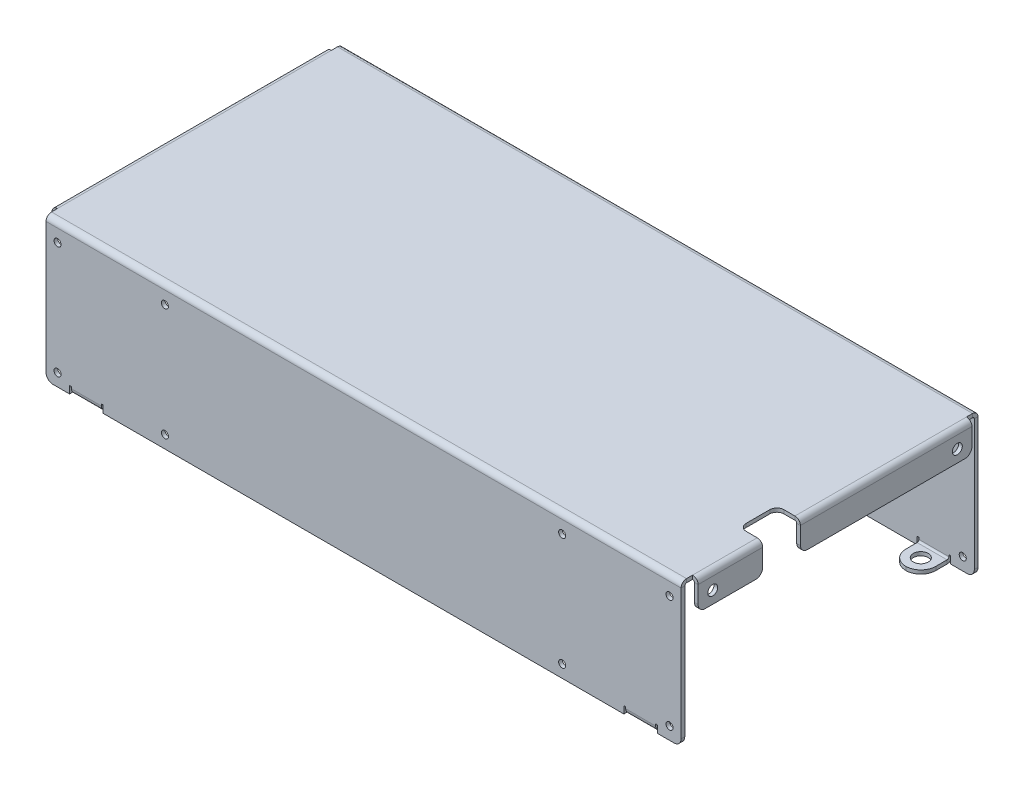
from build123d import *

# Parameters (mm, degrees)
SKETCH1_W                = 269.61
SKETCH1_H                = 121.4
BASE_FLANGE1_DEPTH       = 1.57
EDGE_FLANGE1_DEPTH       = 269.61
EDGE_FLANGE1_BEND_DEPTH  = 269.61
EDGE_FLANGE2_DEPTH       = 121.4
EDGE_FLANGE2_BEND_DEPTH  = 121.4
SKETCH30_W               = 0.8
SKETCH30_H               = 2.34
CUT_EXTRUDE1_DEPTH       = 170
EDGE_FLANGE3_START       = -124.005
EDGE_FLANGE3_DEPTH       = 12.7
EDGE_FLANGE3_START_2     = -124.79
EDGE_FLANGE3_2_OUTLINE_W = 0.775
EDGE_FLANGE3_2_OUTLINE_H = 1.57
EDGE_FLANGE3_2_DEPTH     = 0.785
EDGE_FLANGE3_START_3     = -111.305
EDGE_FLANGE3_3_OUTLINE_W = 0.775
EDGE_FLANGE3_3_OUTLINE_H = 1.57
EDGE_FLANGE3_3_DEPTH     = 0.785
EDGE_FLANGE3_4_DEPTH     = 12.7
FILLET1_R                = 6.35
SKETCH38_R               = 3.175
CUT_EXTRUDE2_DEPTH       = 10
FILLET1_OF_MIRROR2_R     = 6.35
MIRROR4_START            = 110.52
MIRROR4_DEPTH            = 14.27
MIRROR4_2_DEPTH          = 0.785
MIRROR4_START_2          = 124.005
MIRROR4_3_DEPTH          = 0.785
MIRROR4_START_3          = -60.77
MIRROR4_4_OUTLINE_R      = 3.175
MIRROR4_4_DEPTH          = 2.33
MIRROR4_START_4          = 111.305
MIRROR4_5_DEPTH          = 12.7
SKETCH39_R               = 2.11
CUT_EXTRUDE3_DEPTH       = 288.905899
CUT_EXTRUDE4_REACH       = 289.906
CUT_EXTRUDE5_DEPTH       = 2.33
FILLET3_R                = 3
SKETCH46_W               = 12.805982
SKETCH46_H               = 16
CUT_EXTRUDE6_DEPTH       = 20
FILLET4_R                = 3
FILLET5_R                = 3
SKETCH47_R               = 1.5
CUT_EXTRUDE7_DEPTH       = 196.933981
FILLET6_R                = 3


with BuildPart() as part:
    # Base-Flange1: sheet metal written as solids
    # Sketch1 → Base-Flange1 (new body)
    with BuildSketch(Plane(origin=(0, 0, 0), x_dir=(1, 0, 0), z_dir=(0, 1, 0))):
        Rectangle(SKETCH1_W, SKETCH1_H)
    extrude(amount=-BASE_FLANGE1_DEPTH)

    # Edge-Flange1: sheet metal written as solids
    # Edge-Flange1 section (on a plane across the edge) → Edge-Flange1 (add)
    with BuildSketch(Plane(origin=(134.805, -1.57, 61.46), x_dir=(0, 0, -1), z_dir=(-1, 0, 0))):
        with BuildLine():
            Line((-1.57, 0.76), (-1.57, 59.2))
            Line((-1.57, 59.2), (0, 59.2))
            Line((0, 59.2), (0, 0.76))
            ThreePointArc((0, 0.76), (0.222599, 0.222599), (0.76, 0))
            Line((0.76, 0), (0.76, -1.57))
            ThreePointArc((0.76, -1.57), (-0.887559, -0.887559), (-1.57, 0.76))
        make_face()
    extrude(amount=EDGE_FLANGE1_DEPTH)

    # Edge-Flange1 section 2 (on a plane across the edge) → Edge-Flange1 bend (add)
    with BuildSketch(Plane(origin=(-134.805, -1.57, -61.46), x_dir=(0, 0, 1), z_dir=(1, 0, 0))):
        with BuildLine():
            Line((-1.57, 0.76), (-1.57, 59.2))
            Line((-1.57, 59.2), (0, 59.2))
            Line((0, 59.2), (0, 0.76))
            ThreePointArc((0, 0.76), (0.222599, 0.222599), (0.76, 0))
            Line((0.76, 0), (0.76, -1.57))
            ThreePointArc((0.76, -1.57), (-0.887559, -0.887559), (-1.57, 0.76))
        make_face()
    extrude(amount=EDGE_FLANGE1_BEND_DEPTH)

    # Edge-Flange2: sheet metal written as solids
    # Edge-Flange2 section (on a plane across the edge) → Edge-Flange2 (add)
    with BuildSketch(Plane(origin=(135.565, -1.57, -60.7), x_dir=(-1, 0, 0), z_dir=(0, 0, 1))):
        with BuildLine():
            Line((-1.57, 0.76), (-1.57, 11.11))
            Line((-1.57, 11.11), (0, 11.11))
            Line((0, 11.11), (0, 0.76))
            ThreePointArc((0, 0.76), (0.222599, 0.222599), (0.76, 0))
            Line((0.76, 0), (0.76, -1.57))
            ThreePointArc((0.76, -1.57), (-0.887559, -0.887559), (-1.57, 0.76))
        make_face()
    extrude(amount=EDGE_FLANGE2_DEPTH)

    # Edge-Flange2 section 2 (on a plane across the edge) → Edge-Flange2 bend (add)
    with BuildSketch(Plane(origin=(-135.565, -1.57, 60.7), x_dir=(1, 0, 0), z_dir=(0, 0, -1))):
        with BuildLine():
            Line((-1.57, 0.76), (-1.57, 11.11))
            Line((-1.57, 11.11), (0, 11.11))
            Line((0, 11.11), (0, 0.76))
            ThreePointArc((0, 0.76), (0.222599, 0.222599), (0.76, 0))
            Line((0.76, 0), (0.76, -1.57))
            ThreePointArc((0.76, -1.57), (-0.887559, -0.887559), (-1.57, 0.76))
        make_face()
    extrude(amount=EDGE_FLANGE2_BEND_DEPTH)

    # Sketch30 → Cut-Extrude1 (cut)
    with BuildSketch(Plane.XY.offset(63.03)):
        with Locations((-110.905, -59.6)):
            Rectangle(SKETCH30_W, SKETCH30_H)
        with Locations((-124.405, -59.6)):
            Rectangle(SKETCH30_W, SKETCH30_H)
    extrude(amount=-CUT_EXTRUDE1_DEPTH, mode=Mode.SUBTRACT)

    # Edge-Flange3: read off the stored shape, not the designer's step
    # Edge-Flange3 outline → Edge-Flange3 (cut)
    with BuildSketch(Plane.YZ.offset(EDGE_FLANGE3_START)):
        with BuildLine():
            Line((-60.77, 61.46), (-60.642567, 61.46))
            ThreePointArc((-60.642567, 61.46), (-59.792424, 62.597327), (-58.44, 63.03))
            Line((-58.44, 63.03), (-60.77, 63.03))
            Line((-60.77, 63.03), (-60.77, 61.46))
        make_face()
    edge_flange3 = extrude(amount=EDGE_FLANGE3_DEPTH, mode=Mode.SUBTRACT)

    # Edge-Flange3 2 outline → Edge-Flange3 2 (cut)
    with BuildSketch(Plane.YZ.offset(EDGE_FLANGE3_START_2)):
        with Locations((-58.0425, 62.245)):
            Rectangle(EDGE_FLANGE3_2_OUTLINE_W, EDGE_FLANGE3_2_OUTLINE_H)
    edge_flange3_2 = extrude(amount=EDGE_FLANGE3_2_DEPTH, mode=Mode.SUBTRACT)

    # Edge-Flange3 3 outline → Edge-Flange3 3 (cut)
    with BuildSketch(Plane.YZ.offset(EDGE_FLANGE3_START_3)):
        with Locations((-58.0425, 62.245)):
            Rectangle(EDGE_FLANGE3_3_OUTLINE_W, EDGE_FLANGE3_3_OUTLINE_H)
    edge_flange3_3 = extrude(amount=EDGE_FLANGE3_3_DEPTH, mode=Mode.SUBTRACT)

    # Edge-Flange3 4 outline → Edge-Flange3 4 (add)
    with BuildSketch(Plane.YZ.offset(EDGE_FLANGE3_START)):
        with BuildLine():
            ThreePointArc((-60.642567, 61.46), (-60.737921, 61.085305), (-60.77, 60.7))
            Line((-60.77, 60.7), (-60.77, 49.55))
            Line((-60.77, 49.55), (-59.2, 49.55))
            Line((-59.2, 49.55), (-59.2, 60.7))
            ThreePointArc((-59.2, 60.7), (-58.977401, 61.237401), (-58.44, 61.46))
            Line((-58.44, 61.46), (-60.642567, 61.46))
        make_face()
    edge_flange3_4 = extrude(amount=EDGE_FLANGE3_4_DEPTH)

    # Fillet1
    fillet1_edges = [part.edges().sort_by_distance(p)[0] for p in [
        (-111.305, -59.985, 49.55),
        (-124.005, -59.985, 49.55),
    ]]
    fillet(fillet1_edges, radius=FILLET1_R - 0.0001)  # a hair under: the kernel refuses the full size

    # Sketch38 → Cut-Extrude2 (cut)
    with BuildSketch(Plane.XZ.offset(60.77)):
        with Locations(Location((-117.655, 55.9, 0), (0, 0, 270))):
            Circle(SKETCH38_R)
    cut_extrude2 = extrude(amount=-CUT_EXTRUDE2_DEPTH, mode=Mode.SUBTRACT)

    # Mirror2: Edge-Flange3, Edge-Flange3 2, Edge-Flange3 3, Edge-Flange3 4, Cut-Extrude2 across plane
    add(edge_flange3.mirror(Plane.XY), mode=Mode.SUBTRACT)
    add(edge_flange3_2.mirror(Plane.XY), mode=Mode.SUBTRACT)
    add(edge_flange3_3.mirror(Plane.XY), mode=Mode.SUBTRACT)
    add(edge_flange3_4.mirror(Plane.XY))
    add(cut_extrude2.mirror(Plane.XY), mode=Mode.SUBTRACT)

    # Fillet1 of Mirror2
    fillet1_of_mirror2_edges = [part.edges().sort_by_distance(p)[0] for p in [
        (-111.305, -59.985, -49.55),
        (-124.005, -59.985, -49.55),
    ]]
    fillet(fillet1_of_mirror2_edges, radius=FILLET1_OF_MIRROR2_R - 0.0001)  # a hair under: the kernel refuses the full size

    # Mirror4: read off the stored shape, not the designer's step
    # Mirror4 outline → Mirror4 (cut)
    with BuildSketch(Plane.YZ.offset(MIRROR4_START)):
        with BuildLine():
            Line((-60.77, -63.03), (-58.44, -63.03))
            ThreePointArc((-58.44, -63.03), (-59.792424, -62.597327), (-60.642567, -61.46))
            Line((-60.642567, -61.46), (-60.77, -61.46))
            Line((-60.77, -61.46), (-60.77, -63.03))
        make_face()
        with BuildLine():
            ThreePointArc((-60.642567, 61.46), (-59.792424, 62.597327), (-58.44, 63.03))
            Line((-58.44, 63.03), (-60.77, 63.03))
            Line((-60.77, 63.03), (-60.77, 61.46))
            Line((-60.77, 61.46), (-60.642567, 61.46))
        make_face()
    extrude(amount=MIRROR4_DEPTH, mode=Mode.SUBTRACT)

    # Mirror4 2 outline → Mirror4 2 (cut)
    with BuildSketch(Plane.YZ.offset(MIRROR4_START)):
        with BuildLine():
            Line((-57.655, -63.03), (-57.655, -61.46))
            Line((-57.655, -61.46), (-60.642567, -61.46))
            ThreePointArc((-60.642567, -61.46), (-59.792424, -62.597327), (-58.44, -63.03))
            Line((-58.44, -63.03), (-57.655, -63.03))
        make_face()
        with BuildLine():
            Line((-57.655, 61.46), (-57.655, 63.03))
            Line((-57.655, 63.03), (-58.44, 63.03))
            ThreePointArc((-58.44, 63.03), (-59.792424, 62.597327), (-60.642567, 61.46))
            Line((-60.642567, 61.46), (-57.655, 61.46))
        make_face()
    extrude(amount=MIRROR4_2_DEPTH, mode=Mode.SUBTRACT)

    # Mirror4 3 outline → Mirror4 3 (cut)
    with BuildSketch(Plane.YZ.offset(MIRROR4_START_2)):
        with BuildLine():
            Line((-57.655, -63.03), (-57.655, -61.46))
            Line((-57.655, -61.46), (-60.642567, -61.46))
            ThreePointArc((-60.642567, -61.46), (-59.792424, -62.597327), (-58.44, -63.03))
            Line((-58.44, -63.03), (-57.655, -63.03))
        make_face()
        with BuildLine():
            Line((-57.655, 61.46), (-57.655, 63.03))
            Line((-57.655, 63.03), (-58.44, 63.03))
            ThreePointArc((-58.44, 63.03), (-59.792424, 62.597327), (-60.642567, 61.46))
            Line((-60.642567, 61.46), (-57.655, 61.46))
        make_face()
    extrude(amount=MIRROR4_3_DEPTH, mode=Mode.SUBTRACT)

    # Mirror4 4 outline → Mirror4 4 (add)
    # profile 1 of 2: a face of its own
    with BuildSketch(Plane(origin=(0, 0, 0), x_dir=(1, 0, 0), z_dir=(0, 1, 0)).offset(MIRROR4_START_3)):
        with BuildLine():
            Line((124.005, 55.9), (124.005, 61.46))
            Line((124.005, 61.46), (111.305, 61.46))
            Line((111.305, 61.46), (111.305, 55.9))
            ThreePointArc((111.305, 55.9), (113.164872, 51.409872), (117.655, 49.55))
            ThreePointArc((117.655, 49.55), (122.145128, 51.409872), (124.005, 55.9))
        make_face()
        with Locations((117.655, 55.9)):
            Circle(MIRROR4_4_OUTLINE_R, mode=Mode.SUBTRACT)
    # profile 2 of 2: a face of its own
    with BuildSketch(Plane(origin=(0, 0, 0), x_dir=(1, 0, 0), z_dir=(0, 1, 0)).offset(MIRROR4_START_3)):
        with BuildLine():
            Line((111.305, -61.46), (124.005, -61.46))
            Line((124.005, -61.46), (124.005, -55.9))
            ThreePointArc((124.005, -55.9), (122.145128, -51.409872), (117.655, -49.55))
            ThreePointArc((117.655, -49.55), (113.164872, -51.409872), (111.305, -55.9))
            Line((111.305, -55.9), (111.305, -61.46))
        make_face()
        with Locations((117.655, -55.9)):
            Circle(MIRROR4_4_OUTLINE_R, mode=Mode.SUBTRACT)
    extrude(amount=MIRROR4_4_DEPTH)

    # Mirror4 5 outline → Mirror4 5 (cut)
    with BuildSketch(Plane.YZ.offset(MIRROR4_START_4)):
        with BuildLine():
            Line((-60.77, 61.46), (-60.77, 60.7))
            ThreePointArc((-60.77, 60.7), (-60.737921, 61.085305), (-60.642567, 61.46))
            Line((-60.642567, 61.46), (-60.77, 61.46))
        make_face()
        with BuildLine():
            ThreePointArc((-60.642567, -61.46), (-60.737921, -61.085305), (-60.77, -60.7))
            Line((-60.77, -60.7), (-60.77, -61.46))
            Line((-60.77, -61.46), (-60.642567, -61.46))
        make_face()
        with BuildLine():
            ThreePointArc((-58.44, 61.46), (-58.977401, 61.237401), (-59.2, 60.7))
            Line((-59.2, 60.7), (-59.2, -60.7))
            ThreePointArc((-59.2, -60.7), (-58.977401, -61.237401), (-58.44, -61.46))
            Line((-58.44, -61.46), (-58.44, 61.46))
        make_face()
    extrude(amount=MIRROR4_5_DEPTH, mode=Mode.SUBTRACT)

    # Sketch39 → Cut-Extrude3 (cut, through all)
    with BuildSketch(Plane.ZY.offset(137.135)):
        with Locations(Location((51.92, -7.51, 0), (0, 0, 270))):
            Circle(SKETCH39_R)
        with Locations(Location((-51.92, -7.51, 0), (0, 0, 90))):
            Circle(SKETCH39_R)
    extrude(amount=-CUT_EXTRUDE3_DEPTH, mode=Mode.SUBTRACT)

    # Cut-Extrude4: up to this face of the body (flat: up to its plane)
    cut_extrude4_end = Plane(part.part.faces().sort_by_distance((134.805, -30.34235, 62.22599))[0])
    # Sketch40 → Cut-Extrude4 (cut, up to the picked face)
    with BuildSketch(Plane(origin=(137.135, 0, 0), x_dir=(0, 0, -1), z_dir=(1, 0, 0)), mode=Mode.PRIVATE) as cut_extrude4_sk1:
        Polygon((-63.03, -2.33), (-63.03, -13.794636), (-58.13, -13.794636), (-58.13, -2.33), (-58.13, 0.767784), (-63.03, 0.767784), align=None)
    cut_extrude4_tool1 = split(extrude(cut_extrude4_sk1.sketch, amount=-CUT_EXTRUDE4_REACH, mode=Mode.PRIVATE), bisect_by=cut_extrude4_end, keep=Keep.BOTH, mode=Mode.PRIVATE)
    # Sketch40 → Cut-Extrude4 (cut, up to the picked face)
    with BuildSketch(Plane(origin=(137.135, 0, 0), x_dir=(0, 0, -1), z_dir=(1, 0, 0)), mode=Mode.PRIVATE) as cut_extrude4_sk2:
        Polygon((58.13, -2.33), (58.13, 0.767784), (63.03, 0.767784), (63.03, -2.33), (63.03, -13.794636), (58.13, -13.794636), align=None)
    cut_extrude4_tool2 = split(extrude(cut_extrude4_sk2.sketch, amount=-CUT_EXTRUDE4_REACH, mode=Mode.PRIVATE), bisect_by=cut_extrude4_end, keep=Keep.BOTH, mode=Mode.PRIVATE)
    add(cut_extrude4_tool1.solids().sort_by(Axis((137.135, -6.513426, 60.58), (-1, 0, 0)))[0], mode=Mode.SUBTRACT)
    add(cut_extrude4_tool2.solids().sort_by(Axis((137.135, -6.513426, -60.58), (-1, 0, 0)))[0], mode=Mode.SUBTRACT)

    # Sketch45 → Cut-Extrude5 (cut)
    with BuildSketch(Plane.ZY.offset(137.135)):
        Polygon((-58.13, -2.33), (-58.13, 0.767784), (-63.03, 0.767784), (-63.03, -2.33), (-63.03, -13.794636), (-58.13, -13.794636), align=None)
        Polygon((58.13, -13.794636), (63.03, -13.794636), (63.03, -2.33), (63.03, 0.767784), (58.13, 0.767784), (58.13, -2.33), align=None)
    extrude(amount=-CUT_EXTRUDE5_DEPTH, mode=Mode.SUBTRACT)

    # Fillet3
    fillet3_edges = [part.edges().sort_by_distance(p)[0] for p in [
        (136.35, -12.68, -58.13),
        (136.35, -12.68, 58.13),
        (-136.35, -12.68, 58.13),
        (-136.35, -12.68, -58.13),
    ]]
    fillet(fillet3_edges, radius=FILLET3_R)

    # Sketch46 → Cut-Extrude6 (cut)
    with BuildSketch(Plane(origin=(0, 0, 0), x_dir=(1, 0, 0), z_dir=(0, 1, 0))):
        with Locations((133.537991, -22.69)):
            Rectangle(SKETCH46_W, SKETCH46_H)
    extrude(amount=-CUT_EXTRUDE6_DEPTH, mode=Mode.SUBTRACT)

    # Fillet4
    fillet4_edges = [part.edges().sort_by_distance(p)[0] for p in [
        (127.135, -0.785, 30.69),
        (127.135, -0.785, 14.69),
    ]]
    fillet(fillet4_edges, radius=FILLET4_R)

    # Fillet5
    fillet5_edges = [part.edges().sort_by_distance(p)[0] for p in [
        (136.35, -12.68, 14.69),
        (136.35, -12.68, 30.69),
    ]]
    fillet(fillet5_edges, radius=FILLET5_R)

    # Sketch47 → Cut-Extrude7 (cut, through all)
    with BuildSketch(Plane(origin=(0, 0, -63.03), x_dir=(-1, 0, 0), z_dir=(0, 0, -1))):
        with Locations(Location((129.905, -7.68, 0), (0, 0, 90))):
            Circle(SKETCH47_R)
        with Locations(Location((129.905, -55.45, 0), (0, 0, 90))):
            Circle(SKETCH47_R)
        with Locations(Location((84.325, -55.45, 0), (0, 0, 90))):
            Circle(SKETCH47_R)
        with Locations(Location((84.325, -7.68, 0), (0, 0, 90))):
            Circle(SKETCH47_R)
    cut_extrude7 = extrude(amount=-CUT_EXTRUDE7_DEPTH, mode=Mode.SUBTRACT)

    # Mirror5: Cut-Extrude7 across plane
    add(cut_extrude7.mirror(Plane(origin=(0, 0, 0), x_dir=(0, 0, 1), z_dir=(1, 0, 0))), mode=Mode.SUBTRACT)

    # Fillet6
    fillet6_edges = [part.edges().sort_by_distance(p)[0] for p in [
        (134.805, -60.77, 62.245),
        (-134.805, -60.77, 62.245),
        (-134.805, -60.77, -62.245),
        (134.805, -60.77, -62.245),
    ]]
    fillet(fillet6_edges, radius=FILLET6_R)


solid = part.part
